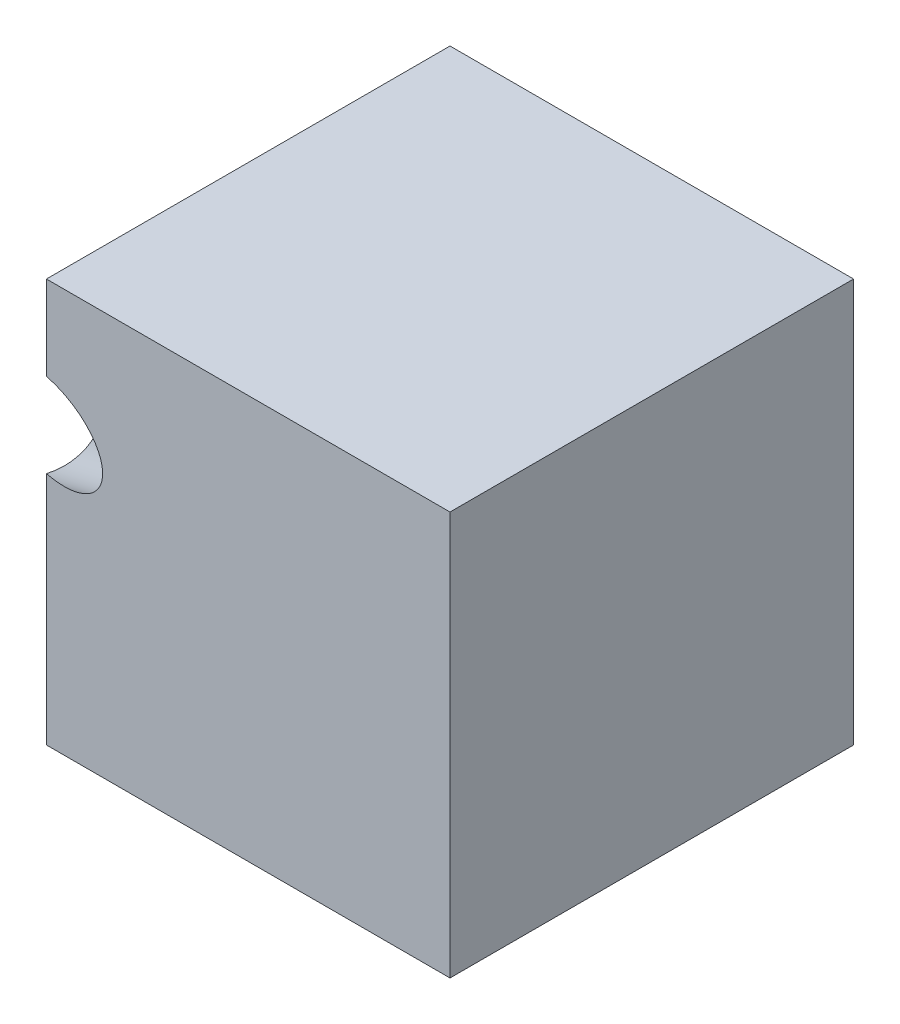
from build123d import *

# Parameters (mm, degrees)
SQUARE_W             = 50.8
SQUARE_H             = 50.8
CUBE_EXTRUSION_DEPTH = 50.8
STICK_CUT_START      = 5
STICK_HOLE_R         = 5
STICK_CUT_DEPTH      = 78.33923171


with BuildPart() as part:
    # Square → Cube-Extrusion (new body)
    with BuildSketch(Plane.XY):
        Rectangle(SQUARE_W, SQUARE_H)
    extrude(amount=CUBE_EXTRUSION_DEPTH)

    # Stick-Hole → Stick-Cut (cut, through all)
    with BuildSketch(Plane(origin=(-28.222222222, 14.111111111, 28.222222222), x_dir=(-0.7453559924999299, -0.29814239699997197, -0.5962847939999439), z_dir=(0.6666666666666666, -0.3333333333333333, -0.6666666666666666)).offset(STICK_CUT_START)):
        with Locations((-14.188625719, -14.230249471)):
            Circle(STICK_HOLE_R)
    extrude(amount=-STICK_CUT_DEPTH, mode=Mode.SUBTRACT)


solid = part.part
